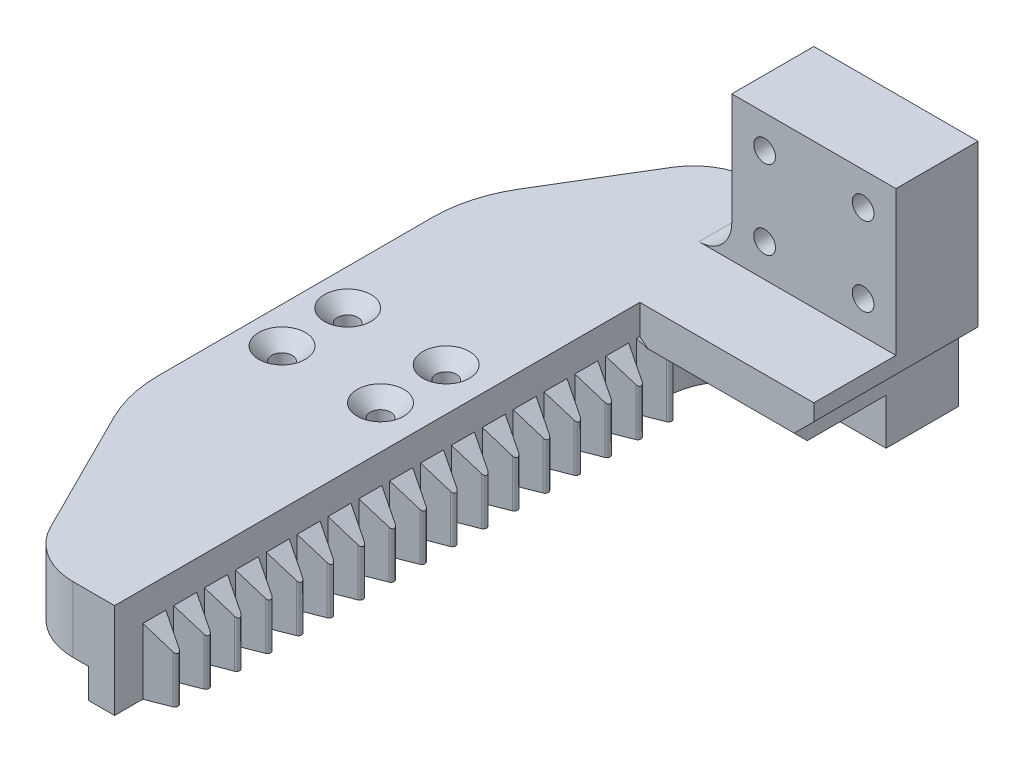
from build123d import *

# Parameters (mm, degrees)
BOSS_EXTRUDE1_DEPTH = 14.5
SKETCH2_W           = 26.5
SKETCH2_H           = 80
CUT_EXTRUDE1_DEPTH  = 15
SKETCH4_W           = 26.5
SKETCH4_H           = 14
CUT_EXTRUDE2_DEPTH  = 7
FILLET1_R           = 10
SKETCH5_W           = 3
SKETCH5_H           = 12
CUT_EXTRUDE3_DEPTH  = 29
CHAMFER1_SIZE       = 3
CHAMFER2_SIZE       = 2
BOSS_EXTRUDE2_DEPTH = 10
LPATTERN1_COUNT     = 17
LPATTERN1_PITCH     = 4.7
CUT_EXTRUDE4_DEPTH  = 76
SKETCH8_W           = 33.454520386
SKETCH8_H           = 107.037620526
CUT_EXTRUDE5_DEPTH  = 4.5
FILLET2_R           = 20
FILLET3_R           = 10
SKETCH9_W           = 25
SKETCH9_H           = 12.5
BOSS_EXTRUDE3_DEPTH = 22
FILLET4_R           = 5
SKETCH10_R          = 1.65
CUT_EXTRUDE6_DEPTH  = 22
SKETCH12_R          = 1.55
CUT_EXTRUDE7_DEPTH  = 22
CHAMFER3_SIZE       = 2
SKETCH13_W          = 23
SKETCH13_H          = 32
CUT_EXTRUDE8_DEPTH  = 3
FILLET5_R           = 5
SKETCH14_W          = 4
SKETCH14_H          = 10
BOSS_EXTRUDE4_DEPTH = 4.5
CHAMFER4_SIZE       = 2


with BuildPart() as part:
    # Sketch1 → Boss-Extrude1 (new body)
    with BuildSketch(Plane(origin=(0, 0, 0), x_dir=(1, 0, 0), z_dir=(0, 1, 0))):
        Polygon((-53.5, -24), (-39, 0), (0, 0), (0, -105), (-39, -105), (-53.5, -76), align=None)
    extrude(amount=BOSS_EXTRUDE1_DEPTH)

    # Sketch2 → Cut-Extrude1 (cut)
    with BuildSketch(Plane(origin=(0, 14.5, 0), x_dir=(1, 0, 0), z_dir=(0, 1, 0))):
        with Locations((-13.25, -65)):
            Rectangle(SKETCH2_W, SKETCH2_H)
    extrude(amount=-CUT_EXTRUDE1_DEPTH, mode=Mode.SUBTRACT)

    # Sketch4 → Cut-Extrude2 (cut)
    with BuildSketch(Plane.XZ):
        with Locations((-13.25, 18)):
            Rectangle(SKETCH4_W, SKETCH4_H)
    extrude(amount=-CUT_EXTRUDE2_DEPTH, mode=Mode.SUBTRACT)

    # Fillet1
    fillet1_edges = [part.edges().sort_by_distance(p)[0] for p in [
        (-26.5, 3.5, 11),
    ]]
    fillet(fillet1_edges, radius=FILLET1_R)

    # Sketch5 → Cut-Extrude3 (cut)
    with BuildSketch(Plane(origin=(0, 0, 0), x_dir=(-1, 0, 0), z_dir=(0, 0, -1))):
        with Locations((1.5, 6)):
            Rectangle(SKETCH5_W, SKETCH5_H)
    extrude(amount=-CUT_EXTRUDE3_DEPTH, mode=Mode.SUBTRACT)

    # Chamfer1
    chamfer1_edges = [part.edges().sort_by_distance(p)[0] for p in [
        (-3, 12, 12.5),
    ]]
    chamfer(chamfer1_edges, length=CHAMFER1_SIZE - 0.0001)  # a hair under: the kernel refuses the full size

    # Chamfer2
    chamfer2_edges = [part.edges().sort_by_distance(p)[0] for p in [
        (-14.75, 7, 25),
    ]]
    chamfer(chamfer2_edges, length=CHAMFER2_SIZE)

    # Sketch6 → Boss-Extrude2 (add)
    with BuildSketch(Plane.XZ):
        with BuildLine():
            Line((-26.5, 25.5), (-26.5, 22))
            Line((-26.5, 22), (-23.198291721, 23.283997664))
            ThreePointArc((-23.198291721, 23.283997664), (-22.879514851, 23.75), (-23.198291721, 24.216002336))
            Line((-23.198291721, 24.216002336), (-26.5, 25.5))
        make_face()
    boss_extrude2 = extrude(amount=-BOSS_EXTRUDE2_DEPTH)

    # LPattern1: Boss-Extrude2 ×17
    with Locations(*[(0, 0, i * LPATTERN1_PITCH) for i in range(1, LPATTERN1_COUNT)]):
        add(boss_extrude2)

    # Sketch7 → Cut-Extrude4 (cut)
    with BuildSketch(Plane.XY.offset(25)):
        Polygon((-26.5, 10), (-22.879514851, 7), (-22.879514851, 10), align=None)
    extrude(amount=CUT_EXTRUDE4_DEPTH, mode=Mode.SUBTRACT)

    # Sketch8 → Cut-Extrude5 (cut)
    with BuildSketch(Plane.XZ):
        with Locations((-47.227260193, 53.518810263)):
            Rectangle(SKETCH8_W, SKETCH8_H)
    extrude(amount=-CUT_EXTRUDE5_DEPTH, mode=Mode.SUBTRACT)

    # Fillet2
    fillet2_edges = [part.edges().sort_by_distance(p)[0] for p in [
        (-53.5, 9.5, 76),
        (-53.5, 9.5, 24),
    ]]
    fillet(fillet2_edges, radius=FILLET2_R)

    # Fillet3
    fillet3_edges = [part.edges().sort_by_distance(p)[0] for p in [
        (-39, 9.5, 105),
        (-39, 9.5, 0),
    ]]
    fillet(fillet3_edges, radius=FILLET3_R)

    # Sketch9 → Boss-Extrude3 (add)
    with BuildSketch(Plane(origin=(0, 14.5, 0), x_dir=(1, 0, 0), z_dir=(0, 1, 0))):
        with Locations((-12.5, -6.25)):
            Rectangle(SKETCH9_W, SKETCH9_H)
    extrude(amount=BOSS_EXTRUDE3_DEPTH)

    # Fillet4
    fillet4_edges = [part.edges().sort_by_distance(p)[0] for p in [
        (-25, 14.5, 6.25),
    ]]
    fillet(fillet4_edges, radius=FILLET4_R)

    # Sketch10 → Cut-Extrude6 (cut)
    with BuildSketch(Plane.XY.offset(12.5)):
        with Locations((-20, 31.5)):
            Circle(SKETCH10_R)
        with Locations((-5, 31.5)):
            Circle(SKETCH10_R)
        with Locations((-5, 19.5)):
            Circle(SKETCH10_R)
        with Locations((-20, 19.506382114)):
            Circle(SKETCH10_R)
    extrude(amount=-CUT_EXTRUDE6_DEPTH, mode=Mode.SUBTRACT)

    # Sketch12 → Cut-Extrude7 (cut)
    with BuildSketch(Plane(origin=(0, 14.5, 0), x_dir=(1, 0, 0), z_dir=(0, 1, 0))):
        with Locations(Location((-48, -48, 0), (0, 0, 270))):
            Circle(SKETCH12_R)
        with Locations(Location((-33, -48, 0), (0, 0, 270))):
            Circle(SKETCH12_R)
        with Locations(Location((-48, -58, 0), (0, 0, 270))):
            Circle(SKETCH12_R)
        with Locations(Location((-33, -58, 0), (0, 0, 270))):
            Circle(SKETCH12_R)
    extrude(amount=-CUT_EXTRUDE7_DEPTH, mode=Mode.SUBTRACT)

    # Chamfer3
    chamfer3_edges = [part.edges().sort_by_distance(p)[0] for p in [
        (-33, 14.5, 46.45),
        (-48, 14.5, 56.45),
        (-33, 14.5, 56.45),
        (-48, 14.5, 46.45),
    ]]
    chamfer(chamfer3_edges, length=CHAMFER3_SIZE)

    # Sketch13 → Cut-Extrude8 (cut)
    with BuildSketch(Plane.XZ.offset(-4.5)):
        with Locations((-42, 53)):
            Rectangle(SKETCH13_W, SKETCH13_H)
    extrude(amount=-CUT_EXTRUDE8_DEPTH, mode=Mode.SUBTRACT)

    # Fillet5
    fillet5_edges = [part.edges().sort_by_distance(p)[0] for p in [
        (-30.5, 2.25, 0),
    ]]
    fillet(fillet5_edges, radius=FILLET5_R)

    # Sketch14 → Boss-Extrude4 (add)
    with BuildSketch(Plane.XZ.offset(-4.5)):
        with Locations((-32.5, 25)):
            Rectangle(SKETCH14_W, SKETCH14_H)
    extrude(amount=BOSS_EXTRUDE4_DEPTH)

    # Chamfer4
    chamfer4_edges = [part.edges().sort_by_distance(p)[0] for p in [
        (-32.5, 0, 30),
    ]]
    chamfer(chamfer4_edges, length=CHAMFER4_SIZE)


solid = part.part
